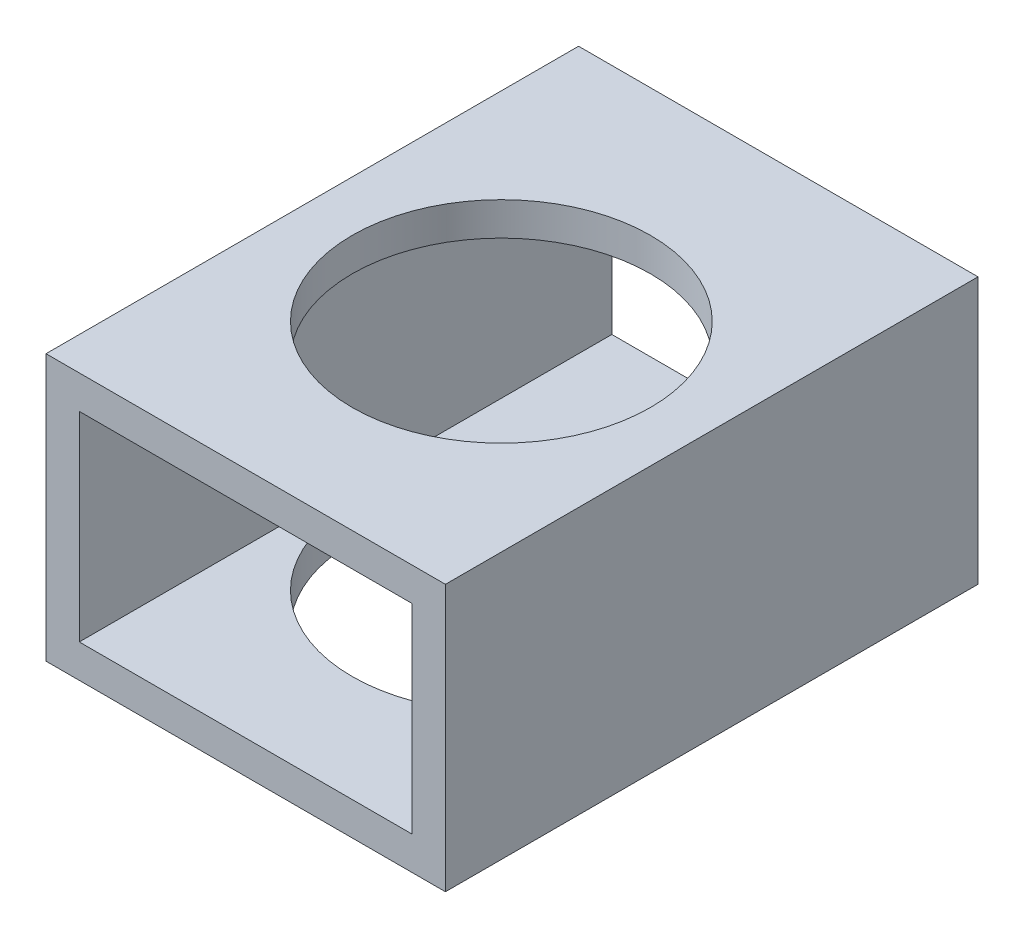
from build123d import *

# Parameters (mm, degrees)
SKETCH1_W           = 38.1
SKETCH1_H           = 25.4
BOSS_EXTRUDE1_DEPTH = 50.8
SKETCH2_W           = 31.75
SKETCH2_H           = 19.05
CUT_EXTRUDE1_DEPTH  = 71.987216582
CUT_EXTRUDE3_DEPTH  = 73.378210129


with BuildPart() as part:
    # Sketch1 → Boss-Extrude1 (new body)
    with BuildSketch(Plane.XY):
        with Locations((-25.81429874, 8.412546426)):
            Rectangle(SKETCH1_W, SKETCH1_H)
    extrude(amount=BOSS_EXTRUDE1_DEPTH)

    # Sketch2 → Cut-Extrude1 (cut, through all)
    with BuildSketch(Plane(origin=(0, 0, 0), x_dir=(-1, 0, 0), z_dir=(0, 0, -1))):
        with Locations((25.81429874, 8.412546426)):
            Rectangle(SKETCH2_W, SKETCH2_H)
    extrude(amount=-CUT_EXTRUDE1_DEPTH, mode=Mode.SUBTRACT)

    # Sketch3 → Cut-Extrude3 (cut, through all)
    with BuildSketch(Plane(origin=(0, 21.112546426, 0), x_dir=(1, 0, 0), z_dir=(0, 1, 0))):
        with BuildLine():
            ThreePointArc((-25.81429874, -12.192), (-35.872185596, -36.473886856), (-11.59029874, -26.416))
            ThreePointArc((-11.59029874, -26.416), (-15.756411885, -16.358113144), (-25.81429874, -12.192))
        make_face()
    extrude(amount=-CUT_EXTRUDE3_DEPTH, mode=Mode.SUBTRACT)


solid = part.part
